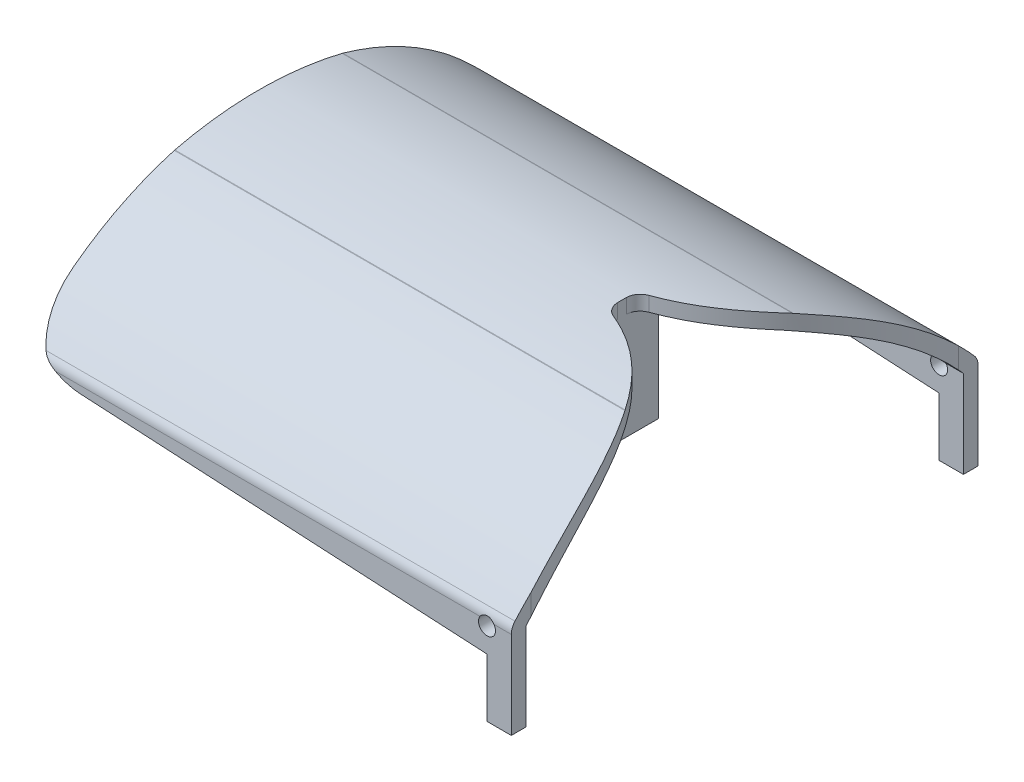
from build123d import *

# Parameters (mm, degrees)
EXTRUDE_THIN1_DEPTH = 100
CUT_EXTRUDE2_DEPTH  = 33.5
FILLET1_R           = 3
SKETCH6_W           = 108.670856817
SKETCH6_H           = 17.879774232
CUT_EXTRUDE3_DEPTH  = 166
BOSS_EXTRUDE1_DEPTH = 10
CUT_EXTRUDE4_DEPTH  = 27
SKETCH11_R          = 1.75
CUT_EXTRUDE5_DEPTH  = 5
SKETCH12_W          = 11.662154679
SKETCH12_H          = 21.882804931
BOSS_EXTRUDE2_DEPTH = 7.5
CUT_EXTRUDE7_DEPTH  = 5
FILLET5_R           = 12
SKETCH16_W          = 5
SKETCH16_H          = 3
BOSS_EXTRUDE3_DEPTH = 4


with BuildPart() as part:
    # Sketch1 → Extrude-Thin1 (new body)
    with BuildSketch(Plane(origin=(0, 0, 0), x_dir=(0, 0, -1), z_dir=(1, 0, 0))):
        with BuildLine():
            Line((45, -32), (45, -18))
            ThreePointArc((45, -18), (32.040658091, -6.957616726), (16.501342128, 0))
            ThreePointArc((16.501342128, 0), (0, 1.972757604), (-16.501342128, 0))
            ThreePointArc((-16.501342128, 0), (-32.040658091, -6.957616726), (-45, -18))
            Line((-45, -18), (-45, -32))
            Line((-45, -32), (-48, -32))
            Line((-48, -32), (-48, -16.88185814))
            ThreePointArc((-48, -16.88185814), (-34.099982932, -4.712774746), (-17.26768466, 2.901081048))
            ThreePointArc((-17.26768466, 2.901081048), (0, 4.972757604), (17.26768466, 2.901081048))
            ThreePointArc((17.26768466, 2.901081048), (34.099982932, -4.712774746), (48, -16.88185814))
            Line((48, -16.88185814), (48, -32))
            Line((48, -32), (45, -32))
        make_face()
    extrude(amount=EXTRUDE_THIN1_DEPTH)

    # Sketch5 → Cut-Extrude2 (cut, symmetric)
    with BuildSketch(Plane(origin=(0, 0, 0), x_dir=(1, 0, 0), z_dir=(0, 1, 0))):
        with BuildLine():
            Line((74.78082212, 3), (74.78082212, -3))
            add(Edge.make_bspline(
                [(74.78082212, -3), (97.634090292, -10.562952057), (100, -44)],
                knots=[0, 0, 0, 1, 1, 1], degree=2))
            Line((100, -44), (100, 44))
            add(Edge.make_bspline(
                [(74.78082212, 3), (97.634090292, 10.562952057), (100, 44)],
                knots=[0, 0, 0, 1, 1, 1], degree=2))
        make_face()
    extrude(amount=CUT_EXTRUDE2_DEPTH, both=True, mode=Mode.SUBTRACT)

    # Fillet1
    fillet1_edges = [part.edges().sort_by_distance(p)[0] for p in [
        (50, -16.88185814, -48),
        (50, -16.88185814, 48),
        (74.78082212, 3.409765032, 3),
        (74.78082212, 3.409765032, -3),
        (46.328171757, 2.901081048, -17.26768466),
        (46.328171757, 2.901081048, 17.26768466),
    ]]
    fillet(fillet1_edges, radius=FILLET1_R)

    # Sketch6 → Cut-Extrude3 (cut)
    with BuildSketch(Plane(origin=(0, 0, -48), x_dir=(-1, 0, 0), z_dir=(0, 0, -1))):
        with Locations((-40.664571591, -32.939887116)):
            Rectangle(SKETCH6_W, SKETCH6_H)
    extrude(amount=-CUT_EXTRUDE3_DEPTH, mode=Mode.SUBTRACT)

    # Sketch8 → Boss-Extrude1 (add, symmetric)
    with BuildSketch(Plane.XY):
        Polygon((0, 1.972757604), (-2.848910504, -18), (7.151089496, -18), (15, 1.972757604), align=None)
    extrude(amount=BOSS_EXTRUDE1_DEPTH, both=True)

    # Sketch10 → Cut-Extrude4 (cut)
    with BuildSketch(Plane.XY.offset(10)):
        with BuildLine():
            Line((-0.348910504, -18), (3.987157996, -18))
            ThreePointArc((3.987157996, -18), (1.819123746, -14.255159652), (-0.348910504, -18))
        make_face()
    extrude(amount=-CUT_EXTRUDE4_DEPTH, mode=Mode.SUBTRACT)

    # Sketch11 → Cut-Extrude5 (cut)
    with BuildSketch(Plane(origin=(0, 0, -48), x_dir=(-1, 0, 0), z_dir=(0, 0, -1))):
        with Locations(Location((-95, -19, 0), (0, 0, 34.849904579))):
            Circle(SKETCH11_R)
    cut_extrude5 = extrude(amount=-CUT_EXTRUDE5_DEPTH, mode=Mode.SUBTRACT)

    # Mirror1: Cut-Extrude5 across plane
    add(cut_extrude5.mirror(Plane.XY), mode=Mode.SUBTRACT)

    # Sketch12 → Boss-Extrude2 (add, symmetric)
    with BuildSketch(Plane.XY):
        with Locations((68.949744781, -8.968644861)):
            Rectangle(SKETCH12_W, SKETCH12_H)
    extrude(amount=BOSS_EXTRUDE2_DEPTH, both=True)

    # Sketch15 → Cut-Extrude7 (cut)
    with BuildSketch(Plane(origin=(0, 0, -48), x_dir=(-1, 0, 0), z_dir=(0, 0, -1))):
        Polygon((-95, -24), (0, -18.860125055), (0, -26.57204687), align=None)
    cut_extrude7 = extrude(amount=-CUT_EXTRUDE7_DEPTH, mode=Mode.SUBTRACT)

    # Mirror2: Cut-Extrude7 across plane
    add(cut_extrude7.mirror(Plane.XY), mode=Mode.SUBTRACT)

    # Fillet5
    # the kernel refuses this fillet: 12 mm, written as the material it takes off along each edge
    with BuildSketch(Plane(origin=(0, -18.860125055, 76.420758066), x_dir=(0, 1, 0), z_dir=(0, 0, -1))) as fillet5_piece_1:
        with BuildLine():
            CenterArc((FILLET5_R * 0.947358602211, FILLET5_R), FILLET5_R, 183.096908366, 86.903091634)
            Line((-FILLET5_R * 0.0511809847104, FILLET5_R * 0.945975067318), (0, 0))
            Line((0, 0), (FILLET5_R * 0.947358602211, 0))
        make_face()
    extrude(amount=59.841516133, mode=Mode.SUBTRACT)
    with BuildSketch(Plane(origin=(0, -18.860125055, -76.420758066), x_dir=(0, 1, 0), z_dir=(0, 0, 1))) as fillet5_piece_2:
        with BuildLine():
            CenterArc((FILLET5_R * 0.947358602211, -FILLET5_R), FILLET5_R, 90, 86.903091634)
            Line((-FILLET5_R * 0.0511809847104, -FILLET5_R * 0.945975067318), (0, 0))
            Line((0, 0), (FILLET5_R * 0.947358602211, 0))
        make_face()
    extrude(amount=59.841516133, mode=Mode.SUBTRACT)

    # Sketch16 → Boss-Extrude3 (add)
    with BuildSketch(Plane.XZ.offset(32)):
        with Locations((97.5, -46.5)):
            Rectangle(SKETCH16_W, SKETCH16_H)
    boss_extrude3 = extrude(amount=BOSS_EXTRUDE3_DEPTH)

    # Mirror3: Boss-Extrude3 across plane
    add(boss_extrude3.mirror(Plane.XY))


solid = part.part
